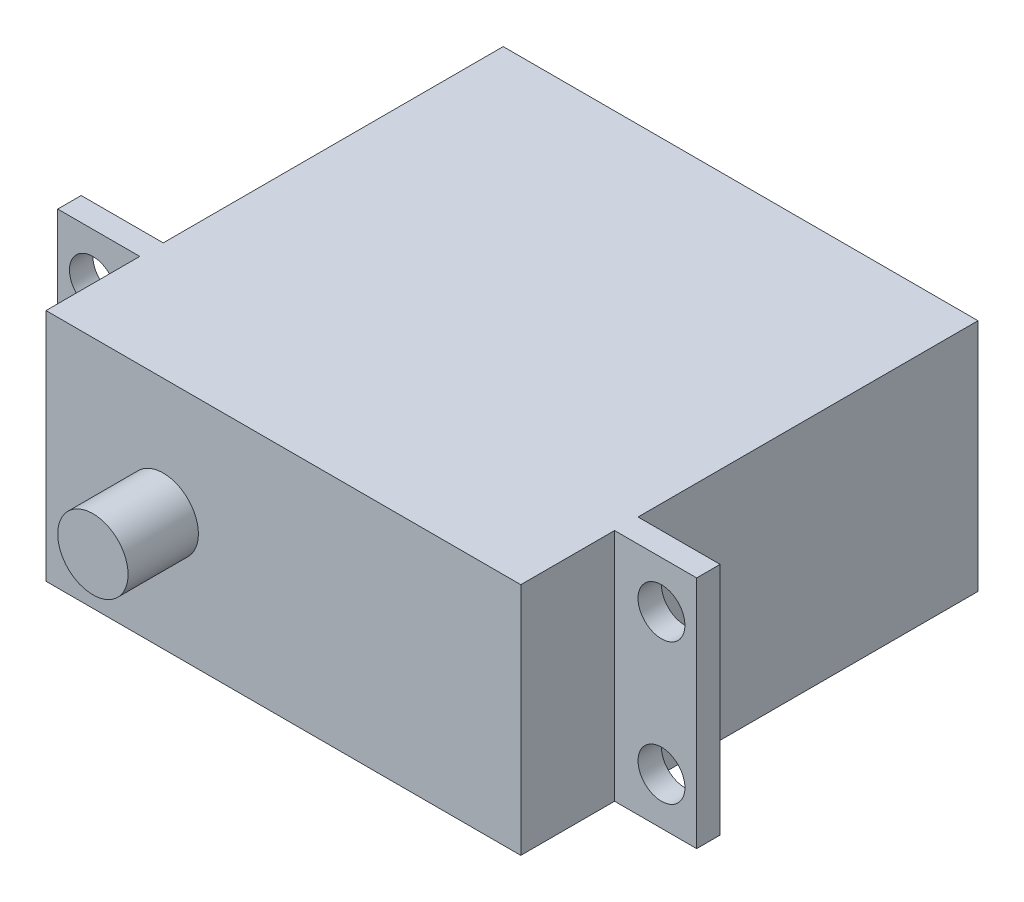
from build123d import *

# Parameters (mm, degrees)
SKETCH1_W           = 40.5
SKETCH1_H           = 20
BOSS_EXTRUDE1_DEPTH = 39
SKETCH2_R           = 3
BOSS_EXTRUDE2_DEPTH = 6
SKETCH3_W           = 2
SKETCH3_H           = 20
BOSS_EXTRUDE3_DEPTH = 7
SKETCH4_R           = 2
CUT_EXTRUDE1_DEPTH  = 7


with BuildPart() as part:
    # Sketch1 → Boss-Extrude1 (new body)
    with BuildSketch(Plane.XY):
        Rectangle(SKETCH1_W, SKETCH1_H)
    extrude(amount=BOSS_EXTRUDE1_DEPTH)

    # Sketch2 → Boss-Extrude2 (add)
    with BuildSketch(Plane.XY.offset(39)):
        with Locations((-10.25, 0)):
            Circle(SKETCH2_R)
    extrude(amount=BOSS_EXTRUDE2_DEPTH)

    # Sketch3 → Boss-Extrude3 (add)
    with BuildSketch(Plane.ZY.offset(20.25)):
        with Locations((30, 0)):
            Rectangle(SKETCH3_W, SKETCH3_H)
    boss_extrude3 = extrude(amount=BOSS_EXTRUDE3_DEPTH)

    # Sketch4 → Cut-Extrude1 (cut)
    with BuildSketch(Plane.XY.offset(31)):
        with Locations((-24.25, 6)):
            Circle(SKETCH4_R)
        with Locations((-24.25, -6)):
            Circle(SKETCH4_R)
    cut_extrude1 = extrude(amount=-CUT_EXTRUDE1_DEPTH, mode=Mode.SUBTRACT)

    # Mirror1: Boss-Extrude3, Cut-Extrude1 across plane
    add(boss_extrude3.mirror(Plane(origin=(0, 0, 0), x_dir=(0, 0, 1), z_dir=(1, 0, 0))))
    add(cut_extrude1.mirror(Plane(origin=(0, 0, 0), x_dir=(0, 0, 1), z_dir=(1, 0, 0))), mode=Mode.SUBTRACT)


solid = part.part
